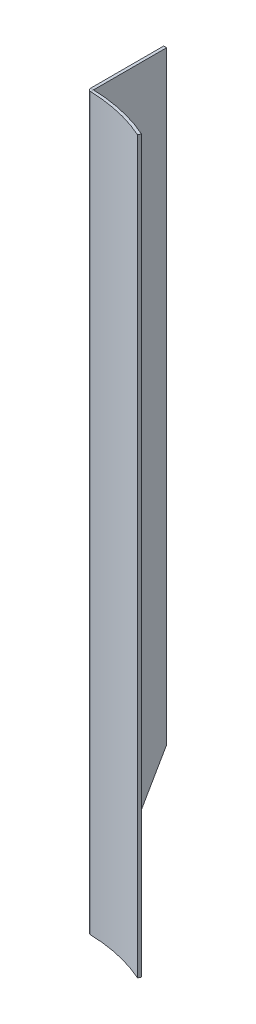
from build123d import *

# Parameters (mm, degrees)
BASE_FLANGE1_DEPTH = 381
CUT_EXTRUDE3_DEPTH = 384.680964443


# Read off the part's stored shape, not the designer's step: Base-Flange1
with BuildPart() as part:
    # Base-Flange1 outline → Base-Flange1 (new body)
    with BuildSketch(Plane(origin=(0, 0, 0), x_dir=(1, 0, 0), z_dir=(0, 1, 0))):
        with BuildLine():
            Line((-19.546720325, -22.80599753), (-19.546720325, 15.29400247))
            Line((-19.546720325, 15.29400247), (-21.070720325, 15.29400247))
            Line((-21.070720325, 15.29400247), (-21.070720325, -22.80599753))
            ThreePointArc((-21.070720325, -22.80599753), (-20.617741894, -23.916410543), (-19.517313006, -24.393131405))
            ThreePointArc((-19.517313006, -24.393131405), (-19.511747403, -24.393260722), (-19.506182287, -24.393409555))
            ThreePointArc((-19.506182287, -24.393409555), (-3.280067744, -26.452317081), (12.23727224, -31.623202224))
            Line((12.23727224, -31.623202224), (12.857840422, -30.231271503))
            ThreePointArc((12.857840422, -30.231271503), (-2.941633017, -24.966370266), (-19.462767824, -22.870028058))
            ThreePointArc((-19.462767824, -22.870028058), (-19.47367545, -22.869736345), (-19.484584032, -22.869482885))
            ThreePointArc((-19.484584032, -22.869482885), (-19.528601188, -22.85041405), (-19.546720325, -22.80599753))
        make_face()
    extrude(amount=BASE_FLANGE1_DEPTH)

    # Sketch5 → Cut-Extrude3 (cut, through all)
    with BuildSketch(Plane(origin=(-19.546720325, 0, 0), x_dir=(0, 0, -1), z_dir=(1, 0, 0))):
        Polygon((-22.80599753, 0), (15.29400247, 65.991135768), (15.29400247, 0), align=None)
    extrude(amount=-CUT_EXTRUDE3_DEPTH, mode=Mode.SUBTRACT)


solid = part.part
